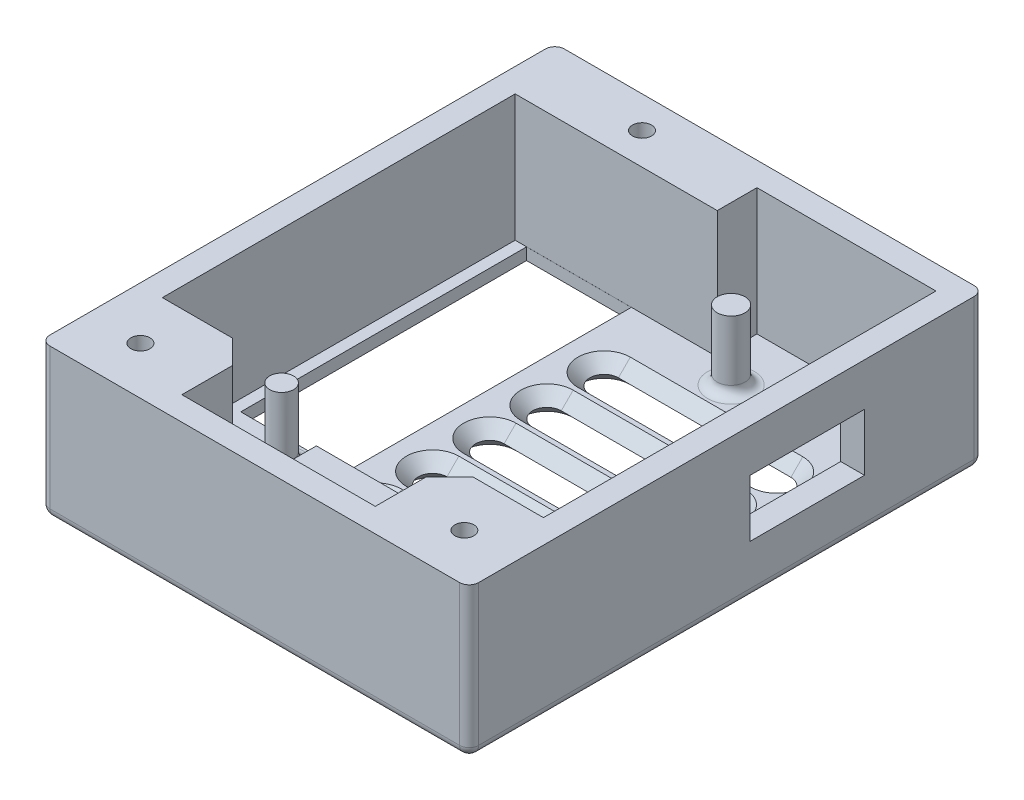
from build123d import *

# Parameters (mm, degrees)
SKETCH1_W           = 45
SKETCH1_H           = 54
SKETCH1_W_2         = 40
SKETCH1_H_2         = 49
BOSS_EXTRUDE1_DEPTH = 13.3
SKETCH3_W           = 45
SKETCH3_H           = 54
BOSS_EXTRUDE2_DEPTH = 2.5
BOSS_EXTRUDE4_DEPTH = 13.3
SKETCH5_W           = 11
SKETCH5_H           = 30
CUT_EXTRUDE1_DEPTH  = 5
SKETCH6_W           = 12
SKETCH6_H           = 6
CUT_EXTRUDE2_DEPTH  = 5
SKETCH7_R           = 1.456693422
SKETCH7_R_2         = 1.2474688
SKETCH7_W           = 8.87889324
SKETCH7_H           = 5.133110155
BOSS_EXTRUDE5_DEPTH = 7.3
FILLET1_R           = 1
CUT_EXTRUDE3_DEPTH  = 7.3
FILLET2_R           = 1
CHAMFER2_SIZE       = 1.25
CHAMFER3_SIZE       = 1.25
CHAMFER4_SIZE       = 1.25
SKETCH9_W           = 21.210465444
SKETCH9_H           = 4.165192571
BOSS_EXTRUDE6_DEPTH = 13.3
SKETCH10_R          = 1
CUT_EXTRUDE4_DEPTH  = 7.3
SKETCH11_R          = 1.25
CUT_EXTRUDE5_DEPTH  = 10


with BuildPart() as part:
    # Sketch1 → Boss-Extrude1 (new body)
    with BuildSketch(Plane(origin=(0, 0, 0), x_dir=(1, 0, 0), z_dir=(0, 1, 0))):
        Rectangle(SKETCH1_W, SKETCH1_H)
        Rectangle(SKETCH1_W_2, SKETCH1_H_2, mode=Mode.SUBTRACT)
    extrude(amount=BOSS_EXTRUDE1_DEPTH)

    # Sketch3 → Boss-Extrude2 (add)
    with BuildSketch(Plane.XZ):
        Rectangle(SKETCH3_W, SKETCH3_H)
    extrude(amount=BOSS_EXTRUDE2_DEPTH)

    # Sketch4 → Boss-Extrude4 (add, through all)
    with BuildSketch(Plane(origin=(0, 0, 0), x_dir=(1, 0, 0), z_dir=(0, 1, 0))):
        Polygon((-12.65, -16.7), (-10.15, -19.2), (-10.15, -24.5), (-20, -24.5), (-20, -16.7), align=None)
        Polygon((12.65, -16.7), (10.15, -19.2), (10.15, -24.5), (20, -24.5), (20, -16.7), align=None)
    extrude(amount=BOSS_EXTRUDE4_DEPTH)

    # Sketch5 → Cut-Extrude1 (cut)
    with BuildSketch(Plane.XZ.offset(2.5)):
        with Locations((-13.3, -5.33)):
            Rectangle(SKETCH5_W, SKETCH5_H)
    extrude(amount=-CUT_EXTRUDE1_DEPTH, mode=Mode.SUBTRACT)

    # Sketch6 → Cut-Extrude2 (cut)
    with BuildSketch(Plane(origin=(22.5, 0, 0), x_dir=(0, 0, -1), z_dir=(1, 0, 0))):
        with Locations((8.5, 5.8)):
            Rectangle(SKETCH6_W, SKETCH6_H)
    extrude(amount=-CUT_EXTRUDE2_DEPTH, mode=Mode.SUBTRACT)

    # Sketch7 → Boss-Extrude5 (add)
    with BuildSketch(Plane(origin=(0, 0, 0), x_dir=(1, 0, 0), z_dir=(0, 1, 0))):
        with Locations(Location((4.5, 18.5, 0), (0, 0, 90))):
            Circle(SKETCH7_R)
        with Locations(Location((-12, -12.183033551, 0), (0, 0, 90))):
            Circle(SKETCH7_R_2)
        with Locations((0, -18.659549076)):
            Rectangle(SKETCH7_W, SKETCH7_H)
    extrude(amount=BOSS_EXTRUDE5_DEPTH)

    # Fillet1
    fillet1_edges = [part.edges().sort_by_distance(p)[0] for p in [
        (-22.5, -2.5, 0),
        (0, -2.5, -27),
        (22.5, -2.5, 0),
        (0, -2.5, 27),
        (-22.5, 5.4, -27),
        (22.5, 5.4, -27),
        (22.5, 5.4, 27),
        (-22.5, 5.4, 27),
    ]]
    fillet(fillet1_edges, radius=FILLET1_R)

    # Sketch8 → Cut-Extrude3 (cut)
    with BuildSketch(Plane(origin=(0, 0, 0), x_dir=(1, 0, 0), z_dir=(0, 1, 0))):
        with BuildLine():
            Line((-3.329584965, 14.5), (14.775033283, 14.5))
            ThreePointArc((14.775033283, 14.5), (16.275033283, 13), (14.775033283, 11.5))
            Line((14.775033283, 11.5), (-3.329584965, 11.5))
            ThreePointArc((-3.329584965, 11.5), (-4.829584965, 13), (-3.329584965, 14.5))
        make_face()
        with BuildLine():
            Line((-3.329584965, 8.5), (14.775033283, 8.5))
            ThreePointArc((14.775033283, 8.5), (16.275033283, 7), (14.775033283, 5.5))
            Line((14.775033283, 5.5), (-3.329584965, 5.5))
            ThreePointArc((-3.329584965, 5.5), (-4.829584965, 7), (-3.329584965, 8.5))
        make_face()
        with BuildLine():
            Line((-3.329584965, 2.5), (14.775033283, 2.5))
            ThreePointArc((14.775033283, 2.5), (16.275033283, 1), (14.775033283, -0.5))
            Line((14.775033283, -0.5), (-3.329584965, -0.5))
            ThreePointArc((-3.329584965, -0.5), (-4.829584965, 1), (-3.329584965, 2.5))
        make_face()
        with BuildLine():
            Line((-3.329584965, -3.5), (14.775033283, -3.5))
            ThreePointArc((14.775033283, -3.5), (16.275033283, -5), (14.775033283, -6.5))
            Line((14.775033283, -6.5), (-3.329584965, -6.5))
            ThreePointArc((-3.329584965, -6.5), (-4.829584965, -5), (-3.329584965, -3.5))
        make_face()
        with BuildLine():
            Line((-3.329584965, -9.5), (14.775033283, -9.5))
            ThreePointArc((14.775033283, -9.5), (16.275033283, -11), (14.775033283, -12.5))
            Line((14.775033283, -12.5), (-3.329584965, -12.5))
            ThreePointArc((-3.329584965, -12.5), (-4.829584965, -11), (-3.329584965, -9.5))
        make_face()
    extrude(amount=-CUT_EXTRUDE3_DEPTH, mode=Mode.SUBTRACT)

    # Fillet2
    fillet2_edges = [part.edges().sort_by_distance(p)[0] for p in [
        (-4.43944662, 0, 18.659549076),
        (0, 0, 21.226104153),
        (4.43944662, 0, 18.659549076),
        (0, 0, 16.092993998),
        (4.5, 0, -17.043306578),
        (-12, 0, 13.430502351),
    ]]
    fillet(fillet2_edges, radius=FILLET2_R)

    # Chamfer2
    chamfer2_edges = [part.edges().sort_by_distance(p)[0] for p in [
        (5.722724159, -2.5, -11.5),
        (16.275033283, -2.5, -13),
        (5.722724159, -2.5, -14.5),
        (-4.829584965, -2.5, -13),
        (5.722724159, -2.5, -5.5),
        (16.275033283, -2.5, -7),
        (5.722724159, -2.5, -8.5),
        (-4.829584965, -2.5, -7),
        (5.722724159, -2.5, 0.5),
        (16.275033283, -2.5, -1),
        (5.722724159, -2.5, -2.5),
        (-4.829584965, -2.5, -1),
        (5.722724159, -2.5, 6.5),
        (16.275033283, -2.5, 5),
        (5.722724159, -2.5, 3.5),
        (-4.829584965, -2.5, 5),
        (5.722724159, -2.5, 12.5),
        (16.275033283, -2.5, 11),
        (5.722724159, -2.5, 9.5),
        (-4.829584965, -2.5, 11),
    ]]
    chamfer(chamfer2_edges, length=CHAMFER2_SIZE)

    # Chamfer3
    chamfer3_edges = [part.edges().sort_by_distance(p)[0] for p in [
        (5.722724159, 0, 12.5),
        (16.275033283, 0, 11),
        (-4.829584965, 0, 11),
        (5.722724159, 0, 9.5),
        (5.722724159, 0, 6.5),
        (16.275033283, 0, 5),
        (-4.829584965, 0, 5),
        (5.722724159, 0, 3.5),
        (5.722724159, 0, 0.5),
        (16.275033283, 0, -1),
        (-4.829584965, 0, -1),
        (5.722724159, 0, -2.5),
        (5.722724159, 0, -5.5),
        (16.275033283, 0, -7),
        (-4.829584965, 0, -7),
        (5.722724159, 0, -8.5),
        (5.722724159, 0, -11.5),
        (16.275033283, 0, -13),
        (-4.829584965, 0, -13),
        (5.722724159, 0, -14.5),
    ]]
    chamfer(chamfer3_edges, length=CHAMFER3_SIZE - 0.0001)  # a hair under: the kernel refuses the full size

    # Chamfer4
    chamfer4_edges = [part.edges().sort_by_distance(p)[0] for p in [
        (-18.8, -2.5, -5.33),
        (-13.3, -2.5, -20.33),
        (-7.8, -2.5, -5.33),
        (-13.3, -2.5, 9.67),
    ]]
    chamfer(chamfer4_edges, length=CHAMFER4_SIZE)

    # Sketch9 → Boss-Extrude6 (add, through all)
    with BuildSketch(Plane(origin=(0, 0, 0), x_dir=(1, 0, 0), z_dir=(0, 1, 0))):
        with Locations((-9.394767278, 22.417403715)):
            Rectangle(SKETCH9_W, SKETCH9_H)
    extrude(amount=BOSS_EXTRUDE6_DEPTH)

    # Sketch10 → Cut-Extrude4 (cut)
    with BuildSketch(Plane(origin=(0, 13.3, 0), x_dir=(1, 0, 0), z_dir=(0, 1, 0))):
        with Locations(Location((-10.018444645, 23.665, 0), (0, 0, 270))):
            Circle(SKETCH10_R)
        with Locations(Location((-17, -22, 0), (0, 0, 270))):
            Circle(SKETCH10_R)
        with Locations(Location((17, -22, 0), (0, 0, 270))):
            Circle(SKETCH10_R)
    extrude(amount=-CUT_EXTRUDE4_DEPTH, mode=Mode.SUBTRACT)

    # Sketch11 → Cut-Extrude5 (cut)
    with BuildSketch(Plane(origin=(0, 0, -27), x_dir=(-1, 0, 0), z_dir=(0, 0, -1))):
        with Locations((-12.75, 3.25)):
            Circle(SKETCH11_R)
    extrude(amount=-CUT_EXTRUDE5_DEPTH, mode=Mode.SUBTRACT)


solid = part.part
